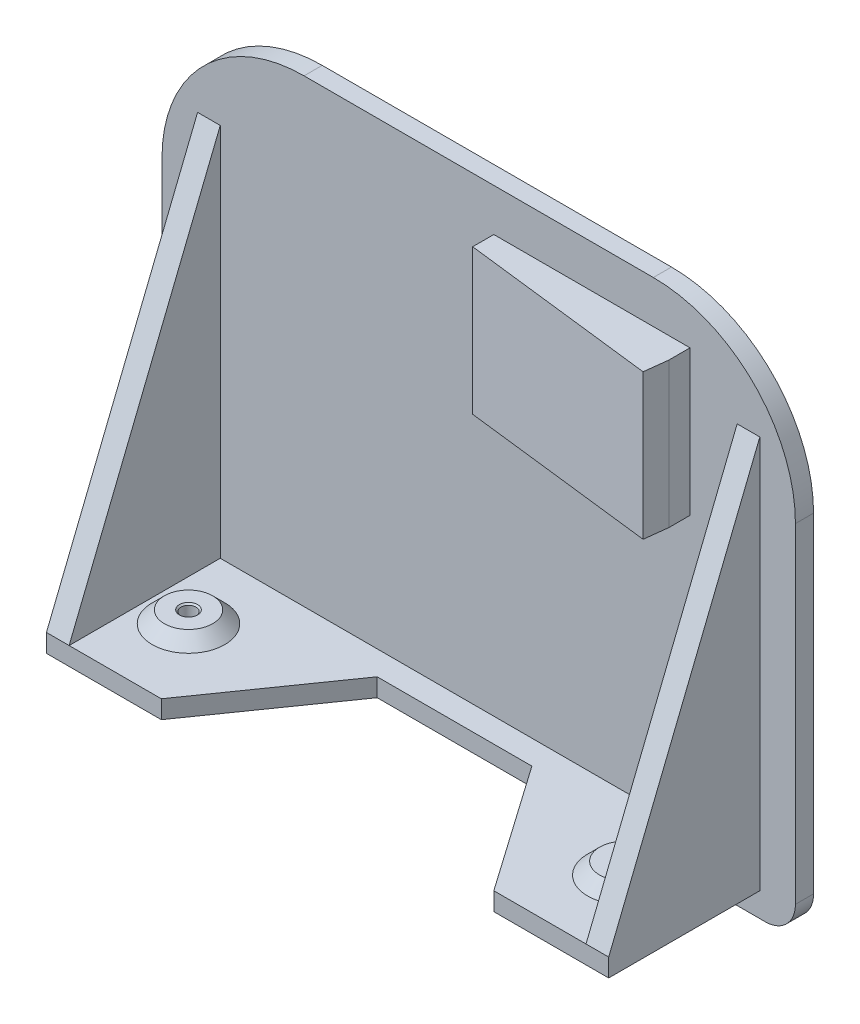
from build123d import *

# Parameters (mm, degrees)
PLATE_DEPTH               = 3
BRACKET_DEPTH             = 46.5
BRACKET_HOLLOW_DEPTH      = 42.75
SKETCH29_R                = 4
INSERT_BOSS_DEPTH         = 2
INSERT_CHAMFER_SIZE       = 2
M3_MOUNT_HOLES_AT_2_COUNT = 2
M3_MOUNT_HOLES_AT_2_PITCH = 72
CUT_EXTRUDE1_DEPTH        = 97.489126654
TOP_CAM_BOSS_START        = 15
TOP_CAM_BOSS_DEPTH        = 24


with BuildPart() as part:
    # Sketch1 → plate (new body)
    with BuildSketch(Plane.XY):
        with BuildLine():
            Line((-28.8875, 46.0375), (28.8875, 46.0375))
            ThreePointArc((28.8875, 46.0375), (45.504509358, 39.154509358), (52.3875, 22.5375))
            Line((52.3875, 22.5375), (52.3875, 0))
            Line((52.3875, 0), (52.3875, -32))
            ThreePointArc((52.3875, -32), (50.923033906, -35.535533906), (47.3875, -37))
            Line((47.3875, -37), (-47.3875, -37))
            ThreePointArc((-47.3875, -37), (-50.923033906, -35.535533906), (-52.3875, -32))
            Line((-52.3875, -32), (-52.3875, 0))
            Line((-52.3875, 0), (-52.3875, 22.5375))
            ThreePointArc((-52.3875, 22.5375), (-45.504509358, 39.154509358), (-28.8875, 46.0375))
        make_face()
    extrude(amount=PLATE_DEPTH)

    # Sketch9 → bracket (add, symmetric)
    with BuildSketch(Plane(origin=(0, 0, 0), x_dir=(0, 0, -1), z_dir=(1, 0, 0))):
        Polygon((-3, 32), (-3, -33), (-28, -33), (-28, -30), align=None)
    extrude(amount=BRACKET_DEPTH, both=True)

    # Sketch10 → bracket hollow (cut, symmetric)
    with BuildSketch(Plane(origin=(0, 0, 0), x_dir=(0, 0, -1), z_dir=(1, 0, 0))):
        Polygon((-28, -30), (-3, -30), (-3, 32), align=None)
    extrude(amount=BRACKET_HOLLOW_DEPTH, both=True, mode=Mode.SUBTRACT)

    # Sketch29 → insert boss (add)
    with BuildSketch(Plane(origin=(0, -30, 0), x_dir=(1, 0, 0), z_dir=(0, 1, 0))):
        with Locations(Location((36, -15, 0), (0, 0, 90))):
            Circle(SKETCH29_R)
        with Locations(Location((-36, -15, 0), (0, 0, 90))):
            Circle(SKETCH29_R)
    extrude(amount=INSERT_BOSS_DEPTH)

    # insert chamfer
    insert_chamfer_edges = [part.edges().sort_by_distance(p)[0] for p in [
        (36, -30, 19),
        (-36, -30, 19),
    ]]
    chamfer(insert_chamfer_edges, length=INSERT_CHAMFER_SIZE - 0.0001)  # a hair under: the kernel refuses the full size

    # Sketch12 → M3 mount holes (revolve, cut)
    with BuildSketch(Plane(origin=(36, -33, 15), x_dir=(0, 0, -1), z_dir=(1, 0, 0))):
        Polygon((0, 0), (0, 5), (1.5, 5), (1.25, 4.75), (1.25, 0.25), (1.5, 0), align=None)
    m3_mount_holes = revolve(axis=Axis((36, -39.35, 15), (0, 1, 0)), mode=Mode.SUBTRACT)

    # M3 mount holes at 2: M3 mount holes ×2
    with Locations(*[(-i * M3_MOUNT_HOLES_AT_2_PITCH, 0, 0) for i in range(1, M3_MOUNT_HOLES_AT_2_COUNT)]):
        add(m3_mount_holes, mode=Mode.SUBTRACT)

    # Sketch30 → Cut-Extrude1 (cut, through all)
    with BuildSketch(Plane(origin=(0, -30, 0), x_dir=(1, 0, 0), z_dir=(0, 1, 0))):
        Polygon((-27.5, -28), (-12.795641698, -7), (12.795641698, -7), (27.5, -28), align=None)
    extrude(amount=-CUT_EXTRUDE1_DEPTH, mode=Mode.SUBTRACT)

    # Sketch5 → top-cam-boss (add)
    with BuildSketch(Plane(origin=(0, 0, 0), x_dir=(1, 0, 0), z_dir=(0, 1, 0)).offset(TOP_CAM_BOSS_START)):
        Polygon((2.5, -6.5), (34.5, -10.315768982), (34.955002904, -6.5), (34.955002904, -3), (2.5, -3), align=None)
    extrude(amount=TOP_CAM_BOSS_DEPTH)


solid = part.part
